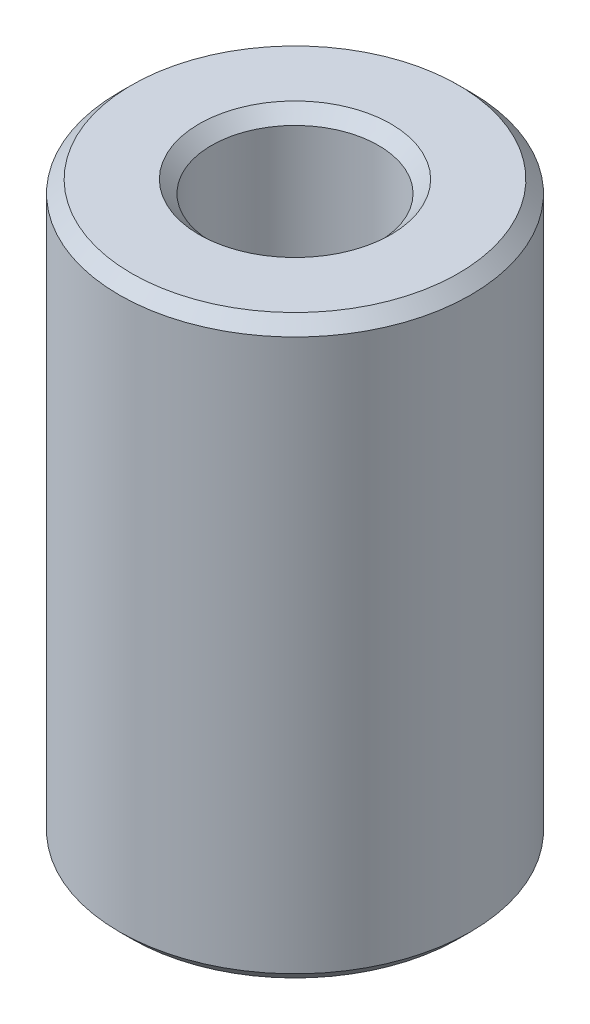
from build123d import *

# Parameters (mm, degrees)
SKETCH1_R           = 55
BOSS_EXTRUDE1_DEPTH = 180.409729087
SKETCH2_R           = 26.142623421
CUT_EXTRUDE1_DEPTH  = 197.46289815
CHAMFER1_SIZE       = 3.888590119


with BuildPart() as part:
    # Sketch1 → Boss-Extrude1 (new body)
    with BuildSketch(Plane(origin=(0, 0, 0), x_dir=(1, 0, 0), z_dir=(0, 1, 0))):
        Circle(SKETCH1_R)
    extrude(amount=BOSS_EXTRUDE1_DEPTH)

    # Sketch2 → Cut-Extrude1 (cut, through all)
    with BuildSketch(Plane(origin=(0, 0, 0), x_dir=(1, 0, 0), z_dir=(0, 1, 0))):
        Circle(SKETCH2_R)
    extrude(amount=CUT_EXTRUDE1_DEPTH, mode=Mode.SUBTRACT)

    # Chamfer1
    chamfer1_edges = [part.edges().sort_by_distance(p)[0] for p in [
        (-26.142623421, 180.409729087, 0),
        (-26.142623421, 0, 0),
        (-55, 0, 0),
        (-55, 180.409729087, 0),
    ]]
    chamfer(chamfer1_edges, length=CHAMFER1_SIZE)


solid = part.part
